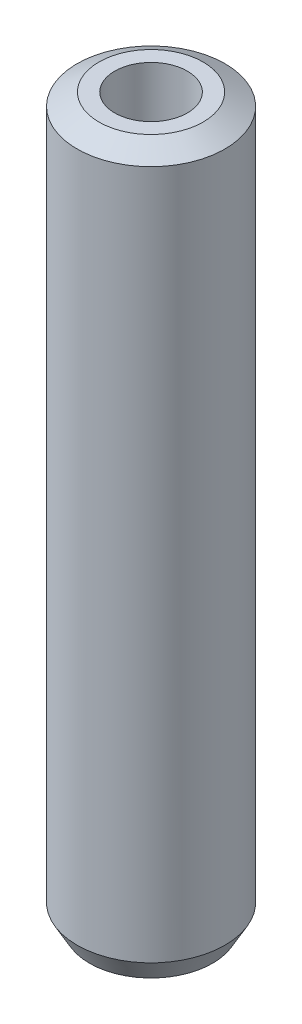
from build123d import *
from OCP.BRepFilletAPI import BRepFilletAPI_MakeChamfer

# Parameters (mm, degrees)
SKETCH1_R           = 7.5
BOSS_EXTRUDE1_DEPTH = 73.403384032
SKETCH2_R           = 3.681305923
CUT_EXTRUDE1_DEPTH  = 75.165738635
CHAMFER1_SIZE       = 1.25476791
CHAMFER1_SIZE2      = 2.218967073


with BuildPart() as part:
    # Sketch1 → Boss-Extrude1 (new body)
    with BuildSketch(Plane(origin=(0, 0, 0), x_dir=(1, 0, 0), z_dir=(0, 1, 0))):
        Circle(SKETCH1_R)
    extrude(amount=BOSS_EXTRUDE1_DEPTH)

    # Sketch2 → Cut-Extrude1 (cut, through all)
    with BuildSketch(Plane(origin=(0, 0, 0), x_dir=(1, 0, 0), z_dir=(0, 1, 0))):
        Circle(SKETCH2_R)
    extrude(amount=CUT_EXTRUDE1_DEPTH, mode=Mode.SUBTRACT)

    # Chamfer1: one chamfer whose edges measure the first distance from different faces: ONE call of the kernel's chamfer builder (chamfer() names one face for all edges)
    chamfer1_edges_1 = [part.edges().sort_by_distance(p)[0] for p in [
        (-7.5, 73.403384032, 0),
    ]]
    chamfer1_side_1 = [part.faces().sort_by_distance(p)[0] for p in [
        (-7.5, 36.701692016, 0),
    ]]
    chamfer1_edges_2 = [part.edges().sort_by_distance(p)[0] for p in [
        (-7.5, 0, 0),
    ]]
    chamfer1_side_2 = [part.faces().sort_by_distance(p)[0] for p in [
        (-7.287867966, 0, 0),
    ]]
    chamfer1 = BRepFilletAPI_MakeChamfer(part.part.solid().wrapped)
    for e in chamfer1_edges_1:
        chamfer1.Add(CHAMFER1_SIZE, CHAMFER1_SIZE2, e.wrapped, chamfer1_side_1[0].wrapped)  # the first distance lies on this face
    for e in chamfer1_edges_2:
        chamfer1.Add(CHAMFER1_SIZE, CHAMFER1_SIZE2, e.wrapped, chamfer1_side_2[0].wrapped)  # the first distance lies on this face
    add(Compound.cast(chamfer1.Shape()), mode=Mode.REPLACE)


solid = part.part
